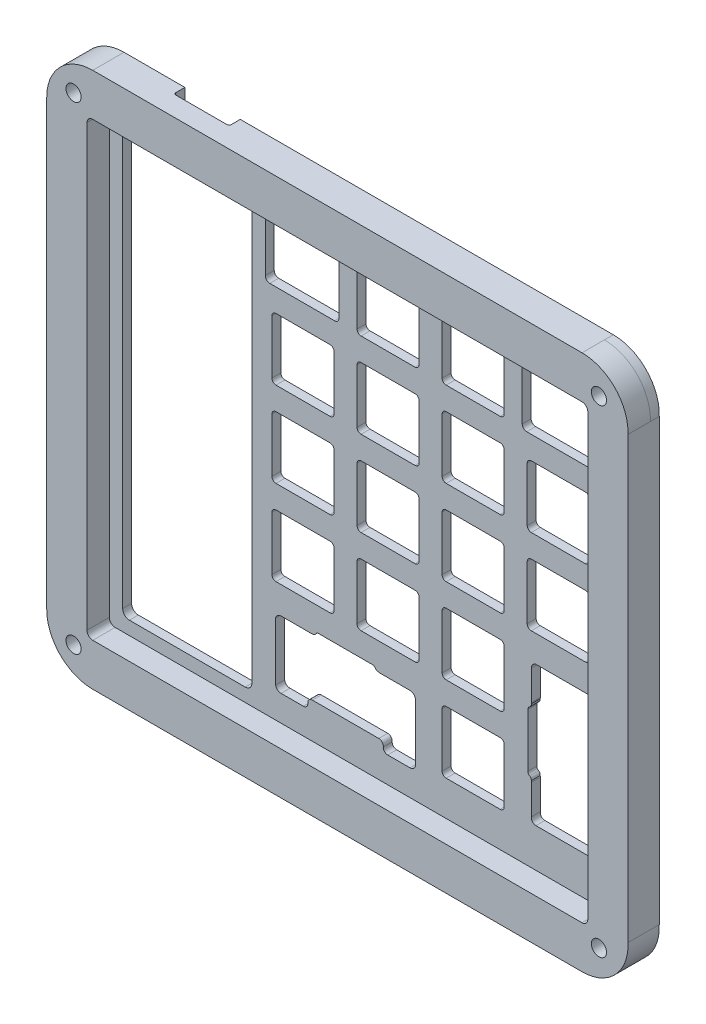
from build123d import *

# Parameters (mm, degrees)
AUFSATZ_LINEAR_START            = 2.8
SKIZZE2_R                       = 1.7
AUFSATZ_LINEAR_AUSTRAGEN1_DEPTH = 2
AUFSATZ_LINEAR_AUSTRAGEN2_DEPTH = 5
SKIZZE8_R                       = 1.7
SCHNITT_LINEAR_AUSTRAGEN3_DEPTH = 242.523870524
SKIZZE3_W                       = 12.4
SKIZZE3_H                       = 2.5
SCHNITT_LINEAR_AUSTRAGEN1_DEPTH = 10
VERRUNDUNG1_R                   = 0.5
SCHNITT_LINEAR_AUSTRAGEN4_REACH = 243.474
AUFSATZ_LINEAR_START_2          = -2
AUFSATZ_LINEAR_AUSTRAGEN3_DEPTH = 2


# Read off the part's stored shape, not the designer's step: Aufsatz-Linear austragen2
with BuildPart() as part:
    # Skizze2 → Aufsatz-Linear austragen1 (new body)
    with BuildSketch(Plane.XY.offset(AUFSATZ_LINEAR_START)):
        with BuildLine():
            ThreePointArc((179.3518, -52.282194674), (176.478891647, -44.747052389), (169.0581, -41.5905))
            Line((169.0581, -41.5905), (85.7196, -41.5905))
            Line((85.7196, -41.5905), (85.55, -41.5905))
            Line((85.55, -41.5905), (85.55, -51.5905))
            Line((85.55, -51.5905), (88.6566, -51.5905))
            ThreePointArc((88.6566, -51.5905), (89.717260172, -52.029839828), (90.1566, -53.0905))
            Line((90.1566, -53.0905), (90.1566, -55.5905))
            Line((90.1566, -55.5905), (90.1566, -147.5967))
            ThreePointArc((90.1566, -147.5967), (89.717260172, -148.657360172), (88.6566, -149.0967))
            Line((88.6566, -149.0967), (62.7338, -149.0967))
            ThreePointArc((62.7338, -149.0967), (61.673139828, -148.657360172), (61.2338, -147.5967))
            Line((61.2338, -147.5967), (61.2338, -55.5905))
            Line((61.2338, -55.5905), (61.2338, -53.0905))
            ThreePointArc((61.2338, -53.0905), (61.673139828, -52.029839828), (62.7338, -51.5905))
            Line((62.7338, -51.5905), (73.15, -51.5905))
            Line((73.15, -51.5905), (73.15, -41.5905))
            Line((73.15, -41.5905), (73.0204, -41.5905))
            Line((73.0204, -41.5905), (59.5275, -41.5905))
            ThreePointArc((59.5275, -41.5905), (52.244300154, -44.607300154), (49.2275, -51.8905))
            Line((49.2275, -51.8905), (49.2275, -151.2967))
            ThreePointArc((49.2275, -151.2967), (52.244300154, -158.579899846), (59.5275, -161.5967))
            Line((59.5275, -161.5967), (169.0581, -161.5967))
            ThreePointArc((169.0581, -161.5967), (176.516871304, -158.405070022), (179.3518, -150.803560266))
            Line((179.3518, -150.803560266), (179.3518, -52.282194674))
        make_face()
        with Locations((55.2338, -155.0967)):
            Circle(SKIZZE2_R, mode=Mode.SUBTRACT)
        with BuildLine():
            ThreePointArc((119.558, -145.3101), (119.265106781, -144.602993219), (118.558, -144.3101))
            Line((118.558, -144.3101), (103.678, -144.3101))
            ThreePointArc((103.678, -144.3101), (102.970893219, -144.602993219), (102.678, -145.3101))
            ThreePointArc((102.678, -145.3101), (102.385106781, -146.017206781), (101.678, -146.3101))
            Line((101.678, -146.3101), (96.678, -146.3101))
            ThreePointArc((96.678, -146.3101), (95.970893219, -146.017206781), (95.678, -145.3101))
            Line((95.678, -145.3101), (95.678, -132.3101))
            ThreePointArc((95.678, -132.3101), (95.970893219, -131.602993219), (96.678, -131.3101))
            Line((96.678, -131.3101), (103.388, -131.3101))
            ThreePointArc((103.388, -131.3101), (103.887418634, -131.175869237), (104.253, -130.8101))
            ThreePointArc((104.253, -130.8101), (104.618581366, -130.444330763), (105.118, -130.3101))
            Line((105.118, -130.3101), (117.118, -130.3101))
            ThreePointArc((117.118, -130.3101), (117.617418634, -130.444330763), (117.983, -130.8101))
            ThreePointArc((117.983, -130.8101), (118.348581366, -131.175869237), (118.848, -131.3101))
            Line((118.848, -131.3101), (125.558, -131.3101))
            ThreePointArc((125.558, -131.3101), (126.265106781, -131.602993219), (126.558, -132.3101))
            Line((126.558, -132.3101), (126.558, -145.3101))
            ThreePointArc((126.558, -145.3101), (126.265106781, -146.017206781), (125.558, -146.3101))
            Line((125.558, -146.3101), (120.558, -146.3101))
            ThreePointArc((120.558, -146.3101), (119.850893219, -146.017206781), (119.558, -145.3101))
        make_face(mode=Mode.SUBTRACT)
        with BuildLine():
            Line((94.5424, -124.3149), (94.5424, -112.2149))
            ThreePointArc((94.5424, -112.2149), (94.835293219, -111.507793219), (95.5424, -111.2149))
            Line((95.5424, -111.2149), (107.6424, -111.2149))
            ThreePointArc((107.6424, -111.2149), (108.349506781, -111.507793219), (108.6424, -112.2149))
            Line((108.6424, -112.2149), (108.6424, -124.3149))
            ThreePointArc((108.6424, -124.3149), (108.349506781, -125.022006781), (107.6424, -125.3149))
            Line((107.6424, -125.3149), (95.5424, -125.3149))
            ThreePointArc((95.5424, -125.3149), (94.835293219, -125.022006781), (94.5424, -124.3149))
        make_face(mode=Mode.SUBTRACT)
        with BuildLine():
            Line((132.6424, -143.3649), (132.6424, -131.2649))
            ThreePointArc((132.6424, -131.2649), (132.935293219, -130.557793219), (133.6424, -130.2649))
            Line((133.6424, -130.2649), (145.7424, -130.2649))
            ThreePointArc((145.7424, -130.2649), (146.449506781, -130.557793219), (146.7424, -131.2649))
            Line((146.7424, -131.2649), (146.7424, -143.3649))
            ThreePointArc((146.7424, -143.3649), (146.449506781, -144.072006781), (145.7424, -144.3649))
            Line((145.7424, -144.3649), (133.6424, -144.3649))
            ThreePointArc((133.6424, -144.3649), (132.935293219, -144.072006781), (132.6424, -143.3649))
        make_face(mode=Mode.SUBTRACT)
        with Locations((172.84742314, -155.0967)):
            Circle(SKIZZE2_R, mode=Mode.SUBTRACT)
        with BuildLine():
            Line((113.5924, -124.3149), (113.5924, -112.2149))
            ThreePointArc((113.5924, -112.2149), (113.885293219, -111.507793219), (114.5924, -111.2149))
            Line((114.5924, -111.2149), (126.6924, -111.2149))
            ThreePointArc((126.6924, -111.2149), (127.399506781, -111.507793219), (127.6924, -112.2149))
            Line((127.6924, -112.2149), (127.6924, -124.3149))
            ThreePointArc((127.6924, -124.3149), (127.399506781, -125.022006781), (126.6924, -125.3149))
            Line((126.6924, -125.3149), (114.5924, -125.3149))
            ThreePointArc((114.5924, -125.3149), (113.885293219, -125.022006781), (113.5924, -124.3149))
        make_face(mode=Mode.SUBTRACT)
        with BuildLine():
            Line((132.6424, -124.3149), (132.6424, -112.2149))
            ThreePointArc((132.6424, -112.2149), (132.935293219, -111.507793219), (133.6424, -111.2149))
            Line((133.6424, -111.2149), (145.7424, -111.2149))
            ThreePointArc((145.7424, -111.2149), (146.449506781, -111.507793219), (146.7424, -112.2149))
            Line((146.7424, -112.2149), (146.7424, -124.3149))
            ThreePointArc((146.7424, -124.3149), (146.449506781, -125.022006781), (145.7424, -125.3149))
            Line((145.7424, -125.3149), (133.6424, -125.3149))
            ThreePointArc((133.6424, -125.3149), (132.935293219, -125.022006781), (132.6424, -124.3149))
        make_face(mode=Mode.SUBTRACT)
        with BuildLine():
            ThreePointArc((153.740000526, -143.2257), (153.032893745, -142.932806781), (152.740000526, -142.2257))
            Line((152.740000526, -142.2257), (152.740000526, -135.516725707))
            ThreePointArc((152.740000526, -135.516725707), (152.606025778, -135.016725444), (152.24, -134.6507))
            ThreePointArc((152.24, -134.6507), (151.874230763, -134.285118634), (151.74, -133.7857))
            Line((151.74, -133.7857), (151.74, -121.786725707))
            ThreePointArc((151.74, -121.786725707), (151.873974748, -121.286725444), (152.240000526, -120.9207))
            ThreePointArc((152.240000526, -120.9207), (152.606026304, -120.554674556), (152.740001052, -120.054674293))
            Line((152.740001052, -120.054674293), (152.740001052, -113.3457))
            ThreePointArc((152.740001052, -113.3457), (153.032894271, -112.638593219), (153.740001052, -112.3457))
            Line((153.740001052, -112.3457), (166.740001052, -112.3457))
            ThreePointArc((166.740001052, -112.3457), (167.447107493, -112.638593405), (167.740000526, -113.3457))
            Line((167.740000526, -113.3457), (167.740000526, -118.3457))
            ThreePointArc((167.740000526, -118.3457), (167.447107307, -119.052806781), (166.740000526, -119.3457))
            ThreePointArc((166.740000526, -119.3457), (166.032893745, -119.638593219), (165.740000526, -120.3457))
            Line((165.740000526, -120.3457), (165.740000526, -135.2257))
            ThreePointArc((165.740000526, -135.2257), (166.032893745, -135.932806781), (166.740000526, -136.2257))
            ThreePointArc((166.740000526, -136.2257), (167.447107307, -136.518593219), (167.740000526, -137.2257))
            Line((167.740000526, -137.2257), (167.740000526, -142.2257))
            ThreePointArc((167.740000526, -142.2257), (167.447107307, -142.932806781), (166.740000526, -143.2257))
            Line((166.740000526, -143.2257), (153.740000526, -143.2257))
        make_face(mode=Mode.SUBTRACT)
        with BuildLine():
            Line((94.5424, -105.2649), (94.5424, -93.1649))
            ThreePointArc((94.5424, -93.1649), (94.835293219, -92.457793219), (95.5424, -92.1649))
            Line((95.5424, -92.1649), (107.6424, -92.1649))
            ThreePointArc((107.6424, -92.1649), (108.349506781, -92.457793219), (108.6424, -93.1649))
            Line((108.6424, -93.1649), (108.6424, -105.2649))
            ThreePointArc((108.6424, -105.2649), (108.349506781, -105.972006781), (107.6424, -106.2649))
            Line((107.6424, -106.2649), (95.5424, -106.2649))
            ThreePointArc((95.5424, -106.2649), (94.835293219, -105.972006781), (94.5424, -105.2649))
        make_face(mode=Mode.SUBTRACT)
        with BuildLine():
            Line((94.5424, -86.2149), (94.5424, -74.1149))
            ThreePointArc((94.5424, -74.1149), (94.835293219, -73.407793219), (95.5424, -73.1149))
            Line((95.5424, -73.1149), (107.6424, -73.1149))
            ThreePointArc((107.6424, -73.1149), (108.349506781, -73.407793219), (108.6424, -74.1149))
            Line((108.6424, -74.1149), (108.6424, -86.2149))
            ThreePointArc((108.6424, -86.2149), (108.349506781, -86.922006781), (107.6424, -87.2149))
            Line((107.6424, -87.2149), (95.5424, -87.2149))
            ThreePointArc((95.5424, -87.2149), (94.835293219, -86.922006781), (94.5424, -86.2149))
        make_face(mode=Mode.SUBTRACT)
        with Locations((55.2338, -48.0905)):
            Circle(SKIZZE2_R, mode=Mode.SUBTRACT)
        with BuildLine():
            ThreePointArc((93.1566, -55.3838), (93.449493219, -54.676693219), (94.1566, -54.3838))
            Line((94.1566, -54.3838), (108.6566, -54.3838))
            ThreePointArc((108.6566, -54.3838), (109.363706781, -54.676693219), (109.6566, -55.3838))
            Line((109.6566, -55.3838), (109.6566, -67.0838))
            ThreePointArc((109.6566, -67.0838), (109.363706781, -67.790906781), (108.6566, -68.0838))
            Line((108.6566, -68.0838), (94.1566, -68.0838))
            ThreePointArc((94.1566, -68.0838), (93.449493219, -67.790906781), (93.1566, -67.0838))
            Line((93.1566, -67.0838), (93.1566, -55.3838))
        make_face(mode=Mode.SUBTRACT)
        with BuildLine():
            Line((113.5924, -105.2649), (113.5924, -93.1649))
            ThreePointArc((113.5924, -93.1649), (113.885293219, -92.457793219), (114.5924, -92.1649))
            Line((114.5924, -92.1649), (126.6924, -92.1649))
            ThreePointArc((126.6924, -92.1649), (127.399506781, -92.457793219), (127.6924, -93.1649))
            Line((127.6924, -93.1649), (127.6924, -105.2649))
            ThreePointArc((127.6924, -105.2649), (127.399506781, -105.972006781), (126.6924, -106.2649))
            Line((126.6924, -106.2649), (114.5924, -106.2649))
            ThreePointArc((114.5924, -106.2649), (113.885293219, -105.972006781), (113.5924, -105.2649))
        make_face(mode=Mode.SUBTRACT)
        with BuildLine():
            Line((132.6424, -105.2649), (132.6424, -93.1649))
            ThreePointArc((132.6424, -93.1649), (132.935293219, -92.457793219), (133.6424, -92.1649))
            Line((133.6424, -92.1649), (145.7424, -92.1649))
            ThreePointArc((145.7424, -92.1649), (146.449506781, -92.457793219), (146.7424, -93.1649))
            Line((146.7424, -93.1649), (146.7424, -105.2649))
            ThreePointArc((146.7424, -105.2649), (146.449506781, -105.972006781), (145.7424, -106.2649))
            Line((145.7424, -106.2649), (133.6424, -106.2649))
            ThreePointArc((133.6424, -106.2649), (132.935293219, -105.972006781), (132.6424, -105.2649))
        make_face(mode=Mode.SUBTRACT)
        with BuildLine():
            Line((113.5924, -86.2149), (113.5924, -74.1149))
            ThreePointArc((113.5924, -74.1149), (113.885293219, -73.407793219), (114.5924, -73.1149))
            Line((114.5924, -73.1149), (126.6924, -73.1149))
            ThreePointArc((126.6924, -73.1149), (127.399506781, -73.407793219), (127.6924, -74.1149))
            Line((127.6924, -74.1149), (127.6924, -86.2149))
            ThreePointArc((127.6924, -86.2149), (127.399506781, -86.922006781), (126.6924, -87.2149))
            Line((126.6924, -87.2149), (114.5924, -87.2149))
            ThreePointArc((114.5924, -87.2149), (113.885293219, -86.922006781), (113.5924, -86.2149))
        make_face(mode=Mode.SUBTRACT)
        with BuildLine():
            Line((132.6424, -86.2149), (132.6424, -74.1149))
            ThreePointArc((132.6424, -74.1149), (132.935293219, -73.407793219), (133.6424, -73.1149))
            Line((133.6424, -73.1149), (145.7424, -73.1149))
            ThreePointArc((145.7424, -73.1149), (146.449506781, -73.407793219), (146.7424, -74.1149))
            Line((146.7424, -74.1149), (146.7424, -86.2149))
            ThreePointArc((146.7424, -86.2149), (146.449506781, -86.922006781), (145.7424, -87.2149))
            Line((145.7424, -87.2149), (133.6424, -87.2149))
            ThreePointArc((133.6424, -87.2149), (132.935293219, -86.922006781), (132.6424, -86.2149))
        make_face(mode=Mode.SUBTRACT)
        with BuildLine():
            Line((151.6924, -105.2649), (151.6924, -93.1649))
            ThreePointArc((151.6924, -93.1649), (151.985293219, -92.457793219), (152.6924, -92.1649))
            Line((152.6924, -92.1649), (164.7924, -92.1649))
            ThreePointArc((164.7924, -92.1649), (165.499506781, -92.457793219), (165.7924, -93.1649))
            Line((165.7924, -93.1649), (165.7924, -105.2649))
            ThreePointArc((165.7924, -105.2649), (165.499506781, -105.972006781), (164.7924, -106.2649))
            Line((164.7924, -106.2649), (152.6924, -106.2649))
            ThreePointArc((152.6924, -106.2649), (151.985293219, -105.972006781), (151.6924, -105.2649))
        make_face(mode=Mode.SUBTRACT)
        with BuildLine():
            Line((151.6924, -86.2149), (151.6924, -74.1149))
            ThreePointArc((151.6924, -74.1149), (151.985293219, -73.407793219), (152.6924, -73.1149))
            Line((152.6924, -73.1149), (164.7924, -73.1149))
            ThreePointArc((164.7924, -73.1149), (165.499506781, -73.407793219), (165.7924, -74.1149))
            Line((165.7924, -74.1149), (165.7924, -86.2149))
            ThreePointArc((165.7924, -86.2149), (165.499506781, -86.922006781), (164.7924, -87.2149))
            Line((164.7924, -87.2149), (152.6924, -87.2149))
            ThreePointArc((152.6924, -87.2149), (151.985293219, -86.922006781), (151.6924, -86.2149))
        make_face(mode=Mode.SUBTRACT)
        with BuildLine():
            ThreePointArc((113.5924, -55.0649), (113.885293219, -54.357793219), (114.5924, -54.0649))
            Line((114.5924, -54.0649), (126.6924, -54.0649))
            ThreePointArc((126.6924, -54.0649), (127.399506781, -54.357793219), (127.6924, -55.0649))
            Line((127.6924, -55.0649), (127.6924, -67.1649))
            ThreePointArc((127.6924, -67.1649), (127.399506781, -67.872006781), (126.6924, -68.1649))
            Line((126.6924, -68.1649), (114.5924, -68.1649))
            ThreePointArc((114.5924, -68.1649), (113.885293219, -67.872006781), (113.5924, -67.1649))
            Line((113.5924, -67.1649), (113.5924, -55.0649))
        make_face(mode=Mode.SUBTRACT)
        with BuildLine():
            Line((132.6424, -67.1649), (132.6424, -55.0649))
            ThreePointArc((132.6424, -55.0649), (132.935293219, -54.357793219), (133.6424, -54.0649))
            Line((133.6424, -54.0649), (145.7424, -54.0649))
            ThreePointArc((145.7424, -54.0649), (146.449506781, -54.357793219), (146.7424, -55.0649))
            Line((146.7424, -55.0649), (146.7424, -67.1649))
            ThreePointArc((146.7424, -67.1649), (146.449506781, -67.872006781), (145.7424, -68.1649))
            Line((145.7424, -68.1649), (133.6424, -68.1649))
            ThreePointArc((133.6424, -68.1649), (132.935293219, -67.872006781), (132.6424, -67.1649))
        make_face(mode=Mode.SUBTRACT)
        with BuildLine():
            ThreePointArc((150.6733, -55.383799922), (150.966193219, -54.676693141), (151.6733, -54.383799922))
            Line((151.6733, -54.383799922), (166.1733, -54.383799922))
            ThreePointArc((166.1733, -54.383799922), (166.880406781, -54.676693141), (167.1733, -55.383799922))
            Line((167.1733, -55.383799922), (167.1733, -67.083799922))
            ThreePointArc((167.1733, -67.083799922), (166.880406781, -67.790906704), (166.1733, -68.083799922))
            Line((166.1733, -68.083799922), (151.6733, -68.083799922))
            ThreePointArc((151.6733, -68.083799922), (150.966193219, -67.790906704), (150.6733, -67.083799922))
            Line((150.6733, -67.083799922), (150.6733, -55.383799922))
        make_face(mode=Mode.SUBTRACT)
        with Locations((172.84742314, -48.0905)):
            Circle(SKIZZE2_R, mode=Mode.SUBTRACT)
    extrude(amount=AUFSATZ_LINEAR_AUSTRAGEN1_DEPTH)

    # Aufsatz-Linear austragen2 outline → Aufsatz-Linear austragen2 (add)
    with BuildSketch(Plane.XY.offset(4.8)):
        with BuildLine():
            ThreePointArc((179.351826533, -52.282195681), (176.478901211, -44.74705102), (169.0581, -41.5905))
            Line((169.0581, -41.5905), (59.5275, -41.5905))
            ThreePointArc((59.5275, -41.5905), (52.244300154, -44.607300154), (49.2275, -51.8905))
            Line((49.2275, -51.8905), (49.2275, -151.2967))
            ThreePointArc((49.2275, -151.2967), (52.244300154, -158.579899846), (59.5275, -161.5967))
            Line((59.5275, -161.5967), (169.0581, -161.5967))
            ThreePointArc((169.0581, -161.5967), (176.516871304, -158.405070022), (179.3518, -150.803560266))
            Line((179.3518, -150.803560266), (179.351826533, -52.282195681))
        make_face()
        with BuildLine():
            ThreePointArc((59.5275, -152.0967), (58.612715957, -151.717784043), (58.2338, -150.803))
            Line((58.2338, -150.803), (58.2338, -52.3842))
            ThreePointArc((58.2338, -52.3842), (58.612715957, -51.469415957), (59.5275, -51.0905))
            Line((59.5275, -51.0905), (169.0581, -51.0905))
            ThreePointArc((169.0581, -51.0905), (169.972884043, -51.469415957), (170.3518, -52.3842))
            Line((170.3518, -52.3842), (170.3518, -150.803))
            ThreePointArc((170.3518, -150.803), (169.972884043, -151.717784043), (169.0581, -152.0967))
            Line((169.0581, -152.0967), (59.5275, -152.0967))
        make_face(mode=Mode.SUBTRACT)
    extrude(amount=AUFSATZ_LINEAR_AUSTRAGEN2_DEPTH)

    # Skizze8 → Schnitt-Linear austragen3 (cut, through all)
    with BuildSketch(Plane(origin=(0, 0, 2.8), x_dir=(-1, 0, 0), z_dir=(0, 0, -1))):
        with Locations((-172.84742314, -155.0967)):
            Circle(SKIZZE8_R)
        with Locations((-55.2338, -155.0967)):
            Circle(SKIZZE8_R)
        with Locations((-55.2338, -48.0905)):
            Circle(SKIZZE8_R)
        with Locations((-172.84742314, -48.0905)):
            Circle(SKIZZE8_R)
    extrude(amount=-SCHNITT_LINEAR_AUSTRAGEN3_DEPTH, mode=Mode.SUBTRACT)

    # Skizze3 → Schnitt-Linear austragen1 (cut)
    with BuildSketch(Plane(origin=(0, -41.5905, 0), x_dir=(1, 0, 0), z_dir=(0, 1, 0))):
        with Locations((79.35, -4.05)):
            Rectangle(SKIZZE3_W, SKIZZE3_H)
    extrude(amount=-SCHNITT_LINEAR_AUSTRAGEN1_DEPTH, mode=Mode.SUBTRACT)

    # Verrundung1
    verrundung1_edges = [part.edges().sort_by_distance(p)[0] for p in [
        (73.15, -46.3405, 5.3),
        (85.55, -46.3405, 5.3),
    ]]
    fillet(verrundung1_edges, radius=VERRUNDUNG1_R)

    # Skizze9 → Schnitt-Linear austragen4 (cut, up to next)
    with BuildSketch(Plane.XY.offset(4.8), mode=Mode.PRIVATE) as schnitt_linear_austragen4_sk1:
        with BuildLine():
            Line((152.740001052, -113.3457), (167.740000526, -113.3457))
            ThreePointArc((167.740000526, -113.3457), (167.521025851, -112.511512571), (166.740001052, -112.1457))
            Line((166.740001052, -112.1457), (153.740001052, -112.1457))
            ThreePointArc((153.740001052, -112.1457), (153.022771091, -112.564675032), (152.740001052, -113.3457))
        make_face()
    schnitt_linear_austragen4_tool1 = extrude(schnitt_linear_austragen4_sk1.sketch, amount=-SCHNITT_LINEAR_AUSTRAGEN4_REACH, mode=Mode.PRIVATE) & part.part
    # Skizze9 → Schnitt-Linear austragen4 (cut, up to next)
    with BuildSketch(Plane.XY.offset(4.8), mode=Mode.PRIVATE) as schnitt_linear_austragen4_sk2:
        with BuildLine():
            Line((167.740000526, -142.2257), (152.740000526, -142.2257))
            ThreePointArc((152.740000526, -142.2257), (152.958975558, -143.059887473), (153.740000526, -143.4257))
            Line((153.740000526, -143.4257), (166.740000526, -143.4257))
            ThreePointArc((166.740000526, -143.4257), (167.521025494, -143.059887473), (167.740000526, -142.2257))
        make_face()
    schnitt_linear_austragen4_tool2 = extrude(schnitt_linear_austragen4_sk2.sketch, amount=-SCHNITT_LINEAR_AUSTRAGEN4_REACH, mode=Mode.PRIVATE) & part.part
    # Skizze9 → Schnitt-Linear austragen4 (cut, up to next)
    with BuildSketch(Plane.XY.offset(4.8), mode=Mode.PRIVATE) as schnitt_linear_austragen4_sk3:
        with BuildLine():
            Line((95.478, -145.3101), (95.478, -132.3101))
            ThreePointArc((95.478, -132.3101), (95.896975032, -131.592870039), (96.678, -131.3101))
            Line((96.678, -131.3101), (96.678, -146.3101))
            ThreePointArc((96.678, -146.3101), (95.896975032, -146.027329961), (95.478, -145.3101))
        make_face()
    schnitt_linear_austragen4_tool3 = extrude(schnitt_linear_austragen4_sk3.sketch, amount=-SCHNITT_LINEAR_AUSTRAGEN4_REACH, mode=Mode.PRIVATE) & part.part
    # Skizze9 → Schnitt-Linear austragen4 (cut, up to next)
    with BuildSketch(Plane.XY.offset(4.8), mode=Mode.PRIVATE) as schnitt_linear_austragen4_sk4:
        with BuildLine():
            Line((126.758, -132.3101), (126.758, -145.3101))
            ThreePointArc((126.758, -145.3101), (126.339024968, -146.027329961), (125.558, -146.3101))
            Line((125.558, -146.3101), (125.558, -131.3101))
            ThreePointArc((125.558, -131.3101), (126.339024968, -131.592870039), (126.758, -132.3101))
        make_face()
    schnitt_linear_austragen4_tool4 = extrude(schnitt_linear_austragen4_sk4.sketch, amount=-SCHNITT_LINEAR_AUSTRAGEN4_REACH, mode=Mode.PRIVATE) & part.part
    add(schnitt_linear_austragen4_tool1.solids().sort_by_distance((160.279131, -112.755989, 4.8))[0], mode=Mode.SUBTRACT)
    add(schnitt_linear_austragen4_tool2.solids().sort_by_distance((160.240001, -142.816361, 4.8))[0], mode=Mode.SUBTRACT)
    add(schnitt_linear_austragen4_tool3.solids().sort_by_distance((96.08925, -138.8101, 4.8))[0], mode=Mode.SUBTRACT)
    add(schnitt_linear_austragen4_tool4.solids().sort_by_distance((126.14675, -138.8101, 4.8))[0], mode=Mode.SUBTRACT)

    # Skizze10 → Aufsatz-Linear austragen3 (add)
    # profile 1 of 18: a face of its own
    with BuildSketch(Plane.XY.offset(4.8).offset(AUFSATZ_LINEAR_START_2)):
        with BuildLine():
            Line((151.939999947, -133.785597429), (151.94, -121.786725707))
            ThreePointArc((151.94, -121.786725707), (152.047179798, -121.386725497), (152.340000421, -121.093905141))
            ThreePointArc((152.340000421, -121.093905141), (152.634556075, -120.775201242), (152.696716285, -120.3457))
            ThreePointArc((152.696716285, -120.3457), (152.523046826, -120.676638371), (152.240000526, -120.9207))
            ThreePointArc((152.240000526, -120.9207), (151.873974748, -121.286725444), (151.74, -121.786725707))
            Line((151.74, -121.786725707), (151.74, -133.7857))
            ThreePointArc((151.74, -133.7857), (151.874230763, -134.285118634), (152.24, -134.6507))
            ThreePointArc((152.24, -134.6507), (152.5230463, -134.894761629), (152.696715759, -135.2257))
            ThreePointArc((152.696715759, -135.2257), (152.634555549, -134.796198758), (152.339999895, -134.477494859))
            ThreePointArc((152.339999895, -134.477494859), (152.047410121, -134.185074196), (151.939999947, -133.785597429))
        make_face()
    # profile 2 of 18: a face of its own
    with BuildSketch(Plane.XY.offset(4.8).offset(AUFSATZ_LINEAR_START_2)):
        with BuildLine():
            Line((165.540000526, -120.3457), (165.540000526, -135.2257))
            ThreePointArc((165.540000526, -135.2257), (165.905813053, -136.006724968), (166.740000526, -136.2257))
            ThreePointArc((166.740000526, -136.2257), (166.032893745, -135.932806781), (165.740000526, -135.2257))
            Line((165.740000526, -135.2257), (165.740000526, -120.3457))
            ThreePointArc((165.740000526, -120.3457), (166.032893745, -119.638593219), (166.740000526, -119.3457))
            ThreePointArc((166.740000526, -119.3457), (165.905813053, -119.564675032), (165.540000526, -120.3457))
        make_face()
    # profile 3 of 18: a face of its own
    with BuildSketch(Plane.XY.offset(4.8).offset(AUFSATZ_LINEAR_START_2)):
        with BuildLine():
            Line((118.558, -144.3101), (103.678, -144.3101))
            ThreePointArc((103.678, -144.3101), (102.970893219, -144.602993219), (102.678, -145.3101))
            ThreePointArc((102.678, -145.3101), (102.896975032, -144.475912527), (103.678, -144.1101))
            Line((103.678, -144.1101), (118.558, -144.1101))
            ThreePointArc((118.558, -144.1101), (119.339024968, -144.475912527), (119.558, -145.3101))
            ThreePointArc((119.558, -145.3101), (119.265106781, -144.602993219), (118.558, -144.3101))
        make_face()
    # profile 4 of 18: a face of its own
    with BuildSketch(Plane.XY.offset(4.8).offset(AUFSATZ_LINEAR_START_2)):
        with BuildLine():
            Line((105.118, -130.3101), (117.118, -130.3101))
            ThreePointArc((117.118, -130.3101), (117.617418634, -130.444330763), (117.983, -130.8101))
            ThreePointArc((117.983, -130.8101), (118.227062958, -131.093147357), (118.558003249, -131.266816748))
            ThreePointArc((118.558003249, -131.266816748), (118.128500172, -131.204656712), (117.809794859, -130.910099895))
            ThreePointArc((117.809794859, -130.910099895), (117.517418565, -130.617535842), (117.118, -130.5101))
            Line((117.118, -130.5101), (105.118205141, -130.510099895))
            ThreePointArc((105.118205141, -130.510099895), (104.718670234, -130.617484505), (104.426205141, -130.910099895))
            ThreePointArc((104.426205141, -130.910099895), (104.107501242, -131.204655549), (103.678, -131.266815759))
            ThreePointArc((103.678, -131.266815759), (104.008938371, -131.0931463), (104.253, -130.8101))
            ThreePointArc((104.253, -130.8101), (104.618581366, -130.444330763), (105.118, -130.3101))
        make_face()
    # profile 5 of 18: a face of its own
    with BuildSketch(Plane.XY.offset(4.8).offset(AUFSATZ_LINEAR_START_2)):
        with BuildLine():
            Line((132.6424, -55.0649), (132.6424, -67.1649))
            ThreePointArc((132.6424, -67.1649), (132.935293219, -67.872006781), (133.6424, -68.1649))
            Line((133.6424, -68.1649), (145.7424, -68.1649))
            ThreePointArc((145.7424, -68.1649), (146.449506781, -67.872006781), (146.7424, -67.1649))
            Line((146.7424, -67.1649), (146.7424, -55.0649))
            ThreePointArc((146.7424, -55.0649), (146.449506781, -54.357793219), (145.7424, -54.0649))
            Line((145.7424, -54.0649), (133.6424, -54.0649))
            ThreePointArc((133.6424, -54.0649), (132.935293219, -54.357793219), (132.6424, -55.0649))
        make_face()
        with BuildLine():
            Line((132.7424, -55.0649), (132.7424, -67.1649))
            ThreePointArc((132.7424, -67.1649), (133.006003897, -67.801296103), (133.6424, -68.0649))
            Line((133.6424, -68.0649), (145.7424, -68.0649))
            ThreePointArc((145.7424, -68.0649), (146.378796103, -67.801296103), (146.6424, -67.1649))
            Line((146.6424, -67.1649), (146.6424, -55.0649))
            ThreePointArc((146.6424, -55.0649), (146.378796103, -54.428503897), (145.7424, -54.1649))
            Line((145.7424, -54.1649), (133.6424, -54.1649))
            ThreePointArc((133.6424, -54.1649), (133.006003897, -54.428503897), (132.7424, -55.0649))
        make_face(mode=Mode.SUBTRACT)
    # profile 6 of 18: a face of its own
    with BuildSketch(Plane.XY.offset(4.8).offset(AUFSATZ_LINEAR_START_2)):
        with BuildLine():
            Line((113.5924, -55.0649), (113.5924, -67.1649))
            ThreePointArc((113.5924, -67.1649), (113.885293219, -67.872006781), (114.5924, -68.1649))
            Line((114.5924, -68.1649), (126.6924, -68.1649))
            ThreePointArc((126.6924, -68.1649), (127.399506781, -67.872006781), (127.6924, -67.1649))
            Line((127.6924, -67.1649), (127.6924, -55.0649))
            ThreePointArc((127.6924, -55.0649), (127.399506781, -54.357793219), (126.6924, -54.0649))
            Line((126.6924, -54.0649), (114.5924, -54.0649))
            ThreePointArc((114.5924, -54.0649), (113.885293219, -54.357793219), (113.5924, -55.0649))
        make_face()
        with BuildLine():
            Line((113.6924, -55.0649), (113.6924, -67.1649))
            ThreePointArc((113.6924, -67.1649), (113.956003897, -67.801296103), (114.5924, -68.0649))
            Line((114.5924, -68.0649), (126.6924, -68.0649))
            ThreePointArc((126.6924, -68.0649), (127.328796103, -67.801296103), (127.5924, -67.1649))
            Line((127.5924, -67.1649), (127.5924, -55.0649))
            ThreePointArc((127.5924, -55.0649), (127.328796103, -54.428503897), (126.6924, -54.1649))
            Line((126.6924, -54.1649), (114.5924, -54.1649))
            ThreePointArc((114.5924, -54.1649), (113.956003897, -54.428503897), (113.6924, -55.0649))
        make_face(mode=Mode.SUBTRACT)
    # profile 7 of 18: a face of its own
    with BuildSketch(Plane.XY.offset(4.8).offset(AUFSATZ_LINEAR_START_2)):
        with BuildLine():
            Line((132.6424, -74.1149), (132.6424, -86.2149))
            ThreePointArc((132.6424, -86.2149), (132.935293219, -86.922006781), (133.6424, -87.2149))
            Line((133.6424, -87.2149), (145.7424, -87.2149))
            ThreePointArc((145.7424, -87.2149), (146.449506781, -86.922006781), (146.7424, -86.2149))
            Line((146.7424, -86.2149), (146.7424, -74.1149))
            ThreePointArc((146.7424, -74.1149), (146.449506781, -73.407793219), (145.7424, -73.1149))
            Line((145.7424, -73.1149), (133.6424, -73.1149))
            ThreePointArc((133.6424, -73.1149), (132.935293219, -73.407793219), (132.6424, -74.1149))
        make_face()
        with BuildLine():
            Line((132.7424, -74.1149), (132.7424, -86.2149))
            ThreePointArc((132.7424, -86.2149), (133.006003897, -86.851296103), (133.6424, -87.1149))
            Line((133.6424, -87.1149), (145.7424, -87.1149))
            ThreePointArc((145.7424, -87.1149), (146.378796103, -86.851296103), (146.6424, -86.2149))
            Line((146.6424, -86.2149), (146.6424, -74.1149))
            ThreePointArc((146.6424, -74.1149), (146.378796103, -73.478503897), (145.7424, -73.2149))
            Line((145.7424, -73.2149), (133.6424, -73.2149))
            ThreePointArc((133.6424, -73.2149), (133.006003897, -73.478503897), (132.7424, -74.1149))
        make_face(mode=Mode.SUBTRACT)
    # profile 8 of 18: a face of its own
    with BuildSketch(Plane.XY.offset(4.8).offset(AUFSATZ_LINEAR_START_2)):
        with BuildLine():
            Line((94.5424, -74.1149), (94.5424, -86.2149))
            ThreePointArc((94.5424, -86.2149), (94.835293219, -86.922006781), (95.5424, -87.2149))
            Line((95.5424, -87.2149), (107.6424, -87.2149))
            ThreePointArc((107.6424, -87.2149), (108.349506781, -86.922006781), (108.6424, -86.2149))
            Line((108.6424, -86.2149), (108.6424, -74.1149))
            ThreePointArc((108.6424, -74.1149), (108.349506781, -73.407793219), (107.6424, -73.1149))
            Line((107.6424, -73.1149), (95.5424, -73.1149))
            ThreePointArc((95.5424, -73.1149), (94.835293219, -73.407793219), (94.5424, -74.1149))
        make_face()
        with BuildLine():
            Line((94.6424, -74.1149), (94.6424, -86.2149))
            ThreePointArc((94.6424, -86.2149), (94.906003897, -86.851296103), (95.5424, -87.1149))
            Line((95.5424, -87.1149), (107.6424, -87.1149))
            ThreePointArc((107.6424, -87.1149), (108.278796103, -86.851296103), (108.5424, -86.2149))
            Line((108.5424, -86.2149), (108.5424, -74.1149))
            ThreePointArc((108.5424, -74.1149), (108.278796103, -73.478503897), (107.6424, -73.2149))
            Line((107.6424, -73.2149), (95.5424, -73.2149))
            ThreePointArc((95.5424, -73.2149), (94.906003897, -73.478503897), (94.6424, -74.1149))
        make_face(mode=Mode.SUBTRACT)
    # profile 9 of 18: a face of its own
    with BuildSketch(Plane.XY.offset(4.8).offset(AUFSATZ_LINEAR_START_2)):
        with BuildLine():
            Line((146.7424, -124.3149), (146.7424, -112.2149))
            ThreePointArc((146.7424, -112.2149), (146.449506781, -111.507793219), (145.7424, -111.2149))
            Line((145.7424, -111.2149), (133.6424, -111.2149))
            ThreePointArc((133.6424, -111.2149), (132.935293219, -111.507793219), (132.6424, -112.2149))
            Line((132.6424, -112.2149), (132.6424, -124.3149))
            ThreePointArc((132.6424, -124.3149), (132.935293219, -125.022006781), (133.6424, -125.3149))
            Line((133.6424, -125.3149), (145.7424, -125.3149))
            ThreePointArc((145.7424, -125.3149), (146.449506781, -125.022006781), (146.7424, -124.3149))
        make_face()
        with BuildLine():
            Line((132.7424, -112.2149), (132.7424, -124.3149))
            ThreePointArc((132.7424, -124.3149), (133.006003897, -124.951296103), (133.6424, -125.2149))
            Line((133.6424, -125.2149), (145.7424, -125.2149))
            ThreePointArc((145.7424, -125.2149), (146.378796103, -124.951296103), (146.6424, -124.3149))
            Line((146.6424, -124.3149), (146.6424, -112.2149))
            ThreePointArc((146.6424, -112.2149), (146.378796103, -111.578503897), (145.7424, -111.3149))
            Line((145.7424, -111.3149), (133.6424, -111.3149))
            ThreePointArc((133.6424, -111.3149), (133.006003897, -111.578503897), (132.7424, -112.2149))
        make_face(mode=Mode.SUBTRACT)
    # profile 10 of 18: a face of its own
    with BuildSketch(Plane.XY.offset(4.8).offset(AUFSATZ_LINEAR_START_2)):
        with BuildLine():
            Line((94.5424, -93.1649), (94.5424, -105.2649))
            ThreePointArc((94.5424, -105.2649), (94.835293219, -105.972006781), (95.5424, -106.2649))
            Line((95.5424, -106.2649), (107.6424, -106.2649))
            ThreePointArc((107.6424, -106.2649), (108.349506781, -105.972006781), (108.6424, -105.2649))
            Line((108.6424, -105.2649), (108.6424, -93.1649))
            ThreePointArc((108.6424, -93.1649), (108.349506781, -92.457793219), (107.6424, -92.1649))
            Line((107.6424, -92.1649), (95.5424, -92.1649))
            ThreePointArc((95.5424, -92.1649), (94.835293219, -92.457793219), (94.5424, -93.1649))
        make_face()
        with BuildLine():
            Line((94.6424, -93.1649), (94.6424, -105.2649))
            ThreePointArc((94.6424, -105.2649), (94.906003897, -105.901296103), (95.5424, -106.1649))
            Line((95.5424, -106.1649), (107.6424, -106.1649))
            ThreePointArc((107.6424, -106.1649), (108.278796103, -105.901296103), (108.5424, -105.2649))
            Line((108.5424, -105.2649), (108.5424, -93.1649))
            ThreePointArc((108.5424, -93.1649), (108.278796103, -92.528503897), (107.6424, -92.2649))
            Line((107.6424, -92.2649), (95.5424, -92.2649))
            ThreePointArc((95.5424, -92.2649), (94.906003897, -92.528503897), (94.6424, -93.1649))
        make_face(mode=Mode.SUBTRACT)
    # profile 11 of 18: a face of its own
    with BuildSketch(Plane.XY.offset(4.8).offset(AUFSATZ_LINEAR_START_2)):
        with BuildLine():
            Line((151.6924, -74.1149), (151.6924, -86.2149))
            ThreePointArc((151.6924, -86.2149), (151.985293219, -86.922006781), (152.6924, -87.2149))
            Line((152.6924, -87.2149), (164.7924, -87.2149))
            ThreePointArc((164.7924, -87.2149), (165.499506781, -86.922006781), (165.7924, -86.2149))
            Line((165.7924, -86.2149), (165.7924, -74.1149))
            ThreePointArc((165.7924, -74.1149), (165.499506781, -73.407793219), (164.7924, -73.1149))
            Line((164.7924, -73.1149), (152.6924, -73.1149))
            ThreePointArc((152.6924, -73.1149), (151.985293219, -73.407793219), (151.6924, -74.1149))
        make_face()
        with BuildLine():
            Line((151.7924, -74.1149), (151.7924, -86.2149))
            ThreePointArc((151.7924, -86.2149), (152.056003897, -86.851296103), (152.6924, -87.1149))
            Line((152.6924, -87.1149), (164.7924, -87.1149))
            ThreePointArc((164.7924, -87.1149), (165.428796103, -86.851296103), (165.6924, -86.2149))
            Line((165.6924, -86.2149), (165.6924, -74.1149))
            ThreePointArc((165.6924, -74.1149), (165.428796103, -73.478503897), (164.7924, -73.2149))
            Line((164.7924, -73.2149), (152.6924, -73.2149))
            ThreePointArc((152.6924, -73.2149), (152.056003897, -73.478503897), (151.7924, -74.1149))
        make_face(mode=Mode.SUBTRACT)
    # profile 12 of 18: a face of its own
    with BuildSketch(Plane.XY.offset(4.8).offset(AUFSATZ_LINEAR_START_2)):
        with BuildLine():
            Line((127.6924, -86.2149), (127.6924, -74.1149))
            ThreePointArc((127.6924, -74.1149), (127.399506781, -73.407793219), (126.6924, -73.1149))
            Line((126.6924, -73.1149), (114.5924, -73.1149))
            ThreePointArc((114.5924, -73.1149), (113.885293219, -73.407793219), (113.5924, -74.1149))
            Line((113.5924, -74.1149), (113.5924, -86.2149))
            ThreePointArc((113.5924, -86.2149), (113.885293219, -86.922006781), (114.5924, -87.2149))
            Line((114.5924, -87.2149), (126.6924, -87.2149))
            ThreePointArc((126.6924, -87.2149), (127.399506781, -86.922006781), (127.6924, -86.2149))
        make_face()
        with BuildLine():
            Line((114.5924, -87.1149), (126.6924, -87.1149))
            ThreePointArc((126.6924, -87.1149), (127.328796103, -86.851296103), (127.5924, -86.2149))
            Line((127.5924, -86.2149), (127.5924, -74.1149))
            ThreePointArc((127.5924, -74.1149), (127.328796103, -73.478503897), (126.6924, -73.2149))
            Line((126.6924, -73.2149), (114.5924, -73.2149))
            ThreePointArc((114.5924, -73.2149), (113.956003897, -73.478503897), (113.6924, -74.1149))
            Line((113.6924, -74.1149), (113.6924, -86.2149))
            ThreePointArc((113.6924, -86.2149), (113.956003897, -86.851296103), (114.5924, -87.1149))
        make_face(mode=Mode.SUBTRACT)
    # profile 13 of 18: a face of its own
    with BuildSketch(Plane.XY.offset(4.8).offset(AUFSATZ_LINEAR_START_2)):
        with BuildLine():
            Line((114.5924, -125.3149), (126.6924, -125.3149))
            ThreePointArc((126.6924, -125.3149), (127.399506781, -125.022006781), (127.6924, -124.3149))
            Line((127.6924, -124.3149), (127.6924, -112.2149))
            ThreePointArc((127.6924, -112.2149), (127.399506781, -111.507793219), (126.6924, -111.2149))
            Line((126.6924, -111.2149), (114.5924, -111.2149))
            ThreePointArc((114.5924, -111.2149), (113.885293219, -111.507793219), (113.5924, -112.2149))
            Line((113.5924, -112.2149), (113.5924, -124.3149))
            ThreePointArc((113.5924, -124.3149), (113.885293219, -125.022006781), (114.5924, -125.3149))
        make_face()
        with BuildLine():
            Line((113.6924, -112.2149), (113.6924, -124.3149))
            ThreePointArc((113.6924, -124.3149), (113.956003897, -124.951296103), (114.5924, -125.2149))
            Line((114.5924, -125.2149), (126.6924, -125.2149))
            ThreePointArc((126.6924, -125.2149), (127.328796103, -124.951296103), (127.5924, -124.3149))
            Line((127.5924, -124.3149), (127.5924, -112.2149))
            ThreePointArc((127.5924, -112.2149), (127.328796103, -111.578503897), (126.6924, -111.3149))
            Line((126.6924, -111.3149), (114.5924, -111.3149))
            ThreePointArc((114.5924, -111.3149), (113.956003897, -111.578503897), (113.6924, -112.2149))
        make_face(mode=Mode.SUBTRACT)
    # profile 14 of 18: a face of its own
    with BuildSketch(Plane.XY.offset(4.8).offset(AUFSATZ_LINEAR_START_2)):
        with BuildLine():
            Line((113.5924, -93.1649), (113.5924, -105.2649))
            ThreePointArc((113.5924, -105.2649), (113.885293219, -105.972006781), (114.5924, -106.2649))
            Line((114.5924, -106.2649), (126.6924, -106.2649))
            ThreePointArc((126.6924, -106.2649), (127.399506781, -105.972006781), (127.6924, -105.2649))
            Line((127.6924, -105.2649), (127.6924, -93.1649))
            ThreePointArc((127.6924, -93.1649), (127.399506781, -92.457793219), (126.6924, -92.1649))
            Line((126.6924, -92.1649), (114.5924, -92.1649))
            ThreePointArc((114.5924, -92.1649), (113.885293219, -92.457793219), (113.5924, -93.1649))
        make_face()
        with BuildLine():
            Line((113.6924, -93.1649), (113.6924, -105.2649))
            ThreePointArc((113.6924, -105.2649), (113.956003897, -105.901296103), (114.5924, -106.1649))
            Line((114.5924, -106.1649), (126.6924, -106.1649))
            ThreePointArc((126.6924, -106.1649), (127.328796103, -105.901296103), (127.5924, -105.2649))
            Line((127.5924, -105.2649), (127.5924, -93.1649))
            ThreePointArc((127.5924, -93.1649), (127.328796103, -92.528503897), (126.6924, -92.2649))
            Line((126.6924, -92.2649), (114.5924, -92.2649))
            ThreePointArc((114.5924, -92.2649), (113.956003897, -92.528503897), (113.6924, -93.1649))
        make_face(mode=Mode.SUBTRACT)
    # profile 15 of 18: a face of its own
    with BuildSketch(Plane.XY.offset(4.8).offset(AUFSATZ_LINEAR_START_2)):
        with BuildLine():
            Line((132.6424, -93.1649), (132.6424, -105.2649))
            ThreePointArc((132.6424, -105.2649), (132.935293219, -105.972006781), (133.6424, -106.2649))
            Line((133.6424, -106.2649), (145.7424, -106.2649))
            ThreePointArc((145.7424, -106.2649), (146.449506781, -105.972006781), (146.7424, -105.2649))
            Line((146.7424, -105.2649), (146.7424, -93.1649))
            ThreePointArc((146.7424, -93.1649), (146.449506781, -92.457793219), (145.7424, -92.1649))
            Line((145.7424, -92.1649), (133.6424, -92.1649))
            ThreePointArc((133.6424, -92.1649), (132.935293219, -92.457793219), (132.6424, -93.1649))
        make_face()
        with BuildLine():
            Line((132.7424, -93.1649), (132.7424, -105.2649))
            ThreePointArc((132.7424, -105.2649), (133.006003897, -105.901296103), (133.6424, -106.1649))
            Line((133.6424, -106.1649), (145.7424, -106.1649))
            ThreePointArc((145.7424, -106.1649), (146.378796103, -105.901296103), (146.6424, -105.2649))
            Line((146.6424, -105.2649), (146.6424, -93.1649))
            ThreePointArc((146.6424, -93.1649), (146.378796103, -92.528503897), (145.7424, -92.2649))
            Line((145.7424, -92.2649), (133.6424, -92.2649))
            ThreePointArc((133.6424, -92.2649), (133.006003897, -92.528503897), (132.7424, -93.1649))
        make_face(mode=Mode.SUBTRACT)
    # profile 16 of 18: a face of its own
    with BuildSketch(Plane.XY.offset(4.8).offset(AUFSATZ_LINEAR_START_2)):
        with BuildLine():
            Line((108.6424, -124.3149), (108.6424, -112.2149))
            ThreePointArc((108.6424, -112.2149), (108.349506781, -111.507793219), (107.6424, -111.2149))
            Line((107.6424, -111.2149), (95.5424, -111.2149))
            ThreePointArc((95.5424, -111.2149), (94.835293219, -111.507793219), (94.5424, -112.2149))
            Line((94.5424, -112.2149), (94.5424, -124.3149))
            ThreePointArc((94.5424, -124.3149), (94.835293219, -125.022006781), (95.5424, -125.3149))
            Line((95.5424, -125.3149), (107.6424, -125.3149))
            ThreePointArc((107.6424, -125.3149), (108.349506781, -125.022006781), (108.6424, -124.3149))
        make_face()
        with BuildLine():
            Line((94.6424, -112.2149), (94.6424, -124.3149))
            ThreePointArc((94.6424, -124.3149), (94.906003897, -124.951296103), (95.5424, -125.2149))
            Line((95.5424, -125.2149), (107.6424, -125.2149))
            ThreePointArc((107.6424, -125.2149), (108.278796103, -124.951296103), (108.5424, -124.3149))
            Line((108.5424, -124.3149), (108.5424, -112.2149))
            ThreePointArc((108.5424, -112.2149), (108.278796103, -111.578503897), (107.6424, -111.3149))
            Line((107.6424, -111.3149), (95.5424, -111.3149))
            ThreePointArc((95.5424, -111.3149), (94.906003897, -111.578503897), (94.6424, -112.2149))
        make_face(mode=Mode.SUBTRACT)
    # profile 17 of 18: a face of its own
    with BuildSketch(Plane.XY.offset(4.8).offset(AUFSATZ_LINEAR_START_2)):
        with BuildLine():
            Line((151.6924, -93.1649), (151.6924, -105.2649))
            ThreePointArc((151.6924, -105.2649), (151.985293219, -105.972006781), (152.6924, -106.2649))
            Line((152.6924, -106.2649), (164.7924, -106.2649))
            ThreePointArc((164.7924, -106.2649), (165.499506781, -105.972006781), (165.7924, -105.2649))
            Line((165.7924, -105.2649), (165.7924, -93.1649))
            ThreePointArc((165.7924, -93.1649), (165.499506781, -92.457793219), (164.7924, -92.1649))
            Line((164.7924, -92.1649), (152.6924, -92.1649))
            ThreePointArc((152.6924, -92.1649), (151.985293219, -92.457793219), (151.6924, -93.1649))
        make_face()
        with BuildLine():
            Line((151.7924, -93.1649), (151.7924, -105.2649))
            ThreePointArc((151.7924, -105.2649), (152.056003897, -105.901296103), (152.6924, -106.1649))
            Line((152.6924, -106.1649), (164.7924, -106.1649))
            ThreePointArc((164.7924, -106.1649), (165.428796103, -105.901296103), (165.6924, -105.2649))
            Line((165.6924, -105.2649), (165.6924, -93.1649))
            ThreePointArc((165.6924, -93.1649), (165.428796103, -92.528503897), (164.7924, -92.2649))
            Line((164.7924, -92.2649), (152.6924, -92.2649))
            ThreePointArc((152.6924, -92.2649), (152.056003897, -92.528503897), (151.7924, -93.1649))
        make_face(mode=Mode.SUBTRACT)
    # profile 18 of 18: a face of its own
    with BuildSketch(Plane.XY.offset(4.8).offset(AUFSATZ_LINEAR_START_2)):
        with BuildLine():
            Line((146.7424, -143.3649), (146.7424, -131.2649))
            ThreePointArc((146.7424, -131.2649), (146.449506781, -130.557793219), (145.7424, -130.2649))
            Line((145.7424, -130.2649), (133.6424, -130.2649))
            ThreePointArc((133.6424, -130.2649), (132.935293219, -130.557793219), (132.6424, -131.2649))
            Line((132.6424, -131.2649), (132.6424, -143.3649))
            ThreePointArc((132.6424, -143.3649), (132.935293219, -144.072006781), (133.6424, -144.3649))
            Line((133.6424, -144.3649), (145.7424, -144.3649))
            ThreePointArc((145.7424, -144.3649), (146.449506781, -144.072006781), (146.7424, -143.3649))
        make_face()
        with BuildLine():
            Line((146.6424, -143.3649), (146.6424, -131.2649))
            ThreePointArc((146.6424, -131.2649), (146.378796103, -130.628503897), (145.7424, -130.3649))
            Line((145.7424, -130.3649), (133.6424, -130.3649))
            ThreePointArc((133.6424, -130.3649), (133.006003897, -130.628503897), (132.7424, -131.2649))
            Line((132.7424, -131.2649), (132.7424, -143.3649))
            ThreePointArc((132.7424, -143.3649), (133.006003897, -144.001296103), (133.6424, -144.2649))
            Line((133.6424, -144.2649), (145.7424, -144.2649))
            ThreePointArc((145.7424, -144.2649), (146.378796103, -144.001296103), (146.6424, -143.3649))
        make_face(mode=Mode.SUBTRACT)
    extrude(amount=AUFSATZ_LINEAR_AUSTRAGEN3_DEPTH)


solid = part.part
